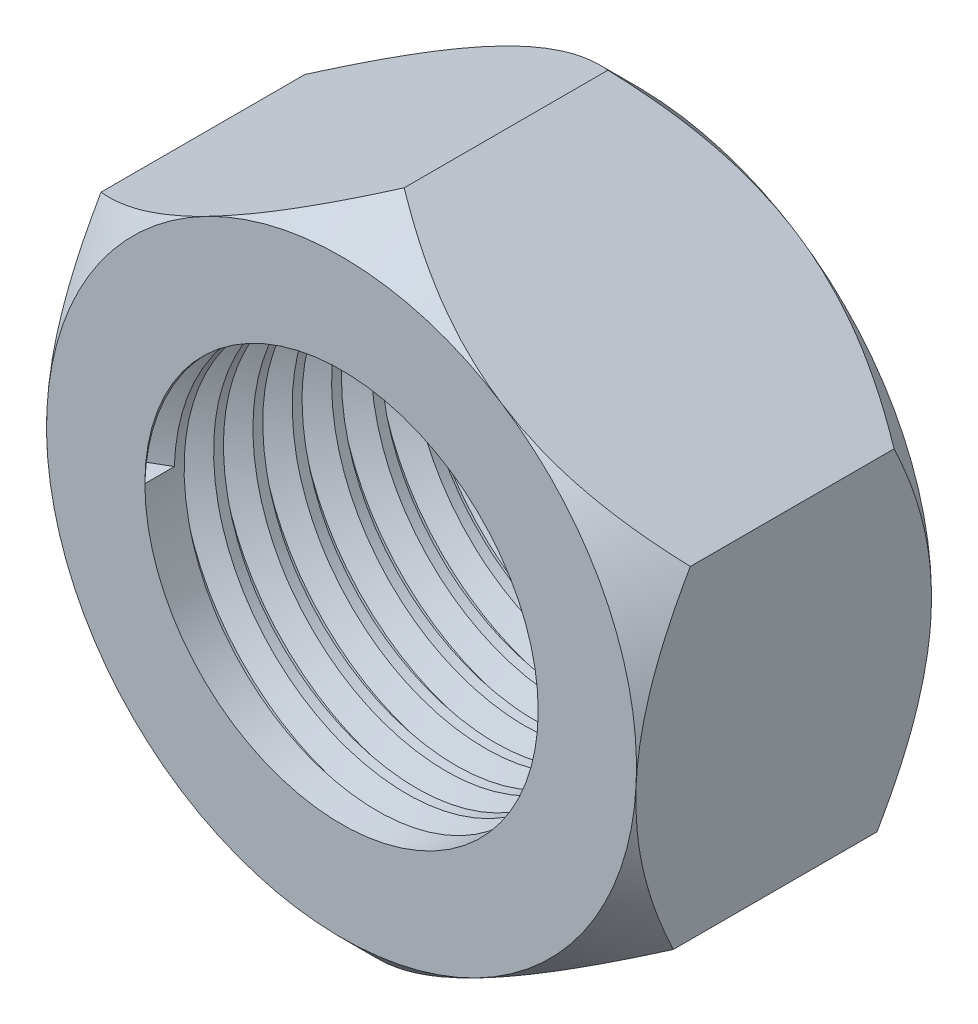
from build123d import *
from build123d.topology import SkipClean

# Parameters (mm, degrees)
SKETCH1_R           = 10
BOSS_EXTRUDE2_DEPTH = 15
SKETCH2_OUTSIDE_W   = 72.57
SKETCH2_OUTSIDE_H   = 76.34
SKETCH2_OUTSIDE_R   = 15
CUT_EXTRUDE3_DEPTH  = 15
CUT_EXTRUDE3_TAPER  = 45
SKETCH3_OUTSIDE_W   = 72.57
SKETCH3_OUTSIDE_H   = 76.34
SKETCH3_OUTSIDE_R   = 15
CUT_EXTRUDE4_DEPTH  = 15
CUT_EXTRUDE4_TAPER  = 45
THREAD1_PITCH       = 2


with BuildPart() as part:
    # Sketch1 → Boss-Extrude2 (new body)
    with BuildSketch(Plane.XY):
        Polygon((-15.414478728, -7.8989775), (-0.866524185, -17.298818914), (14.547954543, -9.399841415), (15.414478728, 7.8989775), (0.866524185, 17.298818914), (-14.547954543, 9.399841415), align=None)
        Circle(SKETCH1_R, mode=Mode.SUBTRACT)
    extrude(amount=-BOSS_EXTRUDE2_DEPTH)

    # Sketch2 outside → Cut-Extrude3 (cut)
    with BuildSketch(Plane.XY):
        Rectangle(SKETCH2_OUTSIDE_W, SKETCH2_OUTSIDE_H)
        Circle(SKETCH2_OUTSIDE_R, mode=Mode.SUBTRACT)
    extrude(amount=-CUT_EXTRUDE3_DEPTH, taper=CUT_EXTRUDE3_TAPER, mode=Mode.SUBTRACT)

    # Sketch3 outside → Cut-Extrude4 (cut)
    with BuildSketch(Plane(origin=(0, 0, -15), x_dir=(-1, 0, 0), z_dir=(0, 0, -1))):
        Rectangle(SKETCH3_OUTSIDE_W, SKETCH3_OUTSIDE_H)
        Circle(SKETCH3_OUTSIDE_R, mode=Mode.SUBTRACT)
    extrude(amount=-CUT_EXTRUDE4_DEPTH, taper=CUT_EXTRUDE4_TAPER, mode=Mode.SUBTRACT)

    # Thread1: the profile of Thread Profile3 profile screwed along a right-hand helix of 7.5 turns, 10 arcs to a turn; built about Z, then put on its axis
    with SkipClean():  # the faces are left unmerged after this step: merging them gives an invalid solid
        thread1_z = Axis((0, 0, 0), (0, 0, 1))
        thread1_corners = [(9.9997, 0, -0.000173205), (11.08253175, 0, 0.624999997), (11.08253175, 0, 0.874999997), (9.9997, 0, 1.5001732)]
        with BuildLine(mode=Mode.PRIVATE) as thread1_profile:
            Line(thread1_corners[0], thread1_corners[1])
            Line(thread1_corners[1], thread1_corners[2])
            Line(thread1_corners[2], thread1_corners[3])
            Line(thread1_corners[3], thread1_corners[0])
        thread1_cap = Face(thread1_profile.wire())
        thread1_turn_angles = [0, 18, 36, 54, 72, 90, 108, 126, 144, 162, 180, 198, 216, 234, 252, 270, 288, 306, 324, 342, 360]
        thread1_turn_weights = [1, 0.9510565162951535, 1, 0.9510565162951535, 1, 0.9510565162951535, 1, 0.9510565162951535, 1, 0.9510565162951535, 1, 0.9510565162951535, 1, 0.9510565162951535, 1, 0.9510565162951535, 1, 0.9510565162951535, 1, 0.9510565162951535, 1]
        thread1_turn_rails = [Edge.make_bspline([Vector(p[0], p[1], 0).rotate(thread1_z, thread1_turn_angles[k]) / thread1_turn_weights[k] + Vector(0, 0, p[2] + THREAD1_PITCH * thread1_turn_angles[k] / 360) for k in range(21)], [0, 0, 0, 1, 1, 2, 2, 3, 3, 4, 4, 5, 5, 6, 6, 7, 7, 8, 8, 9, 9, 10, 10, 10], 2, thread1_turn_weights) for p in thread1_corners]
        thread1_turn_sides = [Face.make_surface_from_curves(thread1_turn_rails[p[0]], thread1_turn_rails[p[1]]) for p in [(0, 1), (1, 2), (2, 3), (3, 0)]]
        thread1_last_angles = [2520, 2538, 2556, 2574, 2592, 2610, 2628, 2646, 2664, 2682, 2700]
        thread1_last_weights = [1, 0.9510565162951535, 1, 0.9510565162951535, 1, 0.9510565162951535, 1, 0.9510565162951535, 1, 0.9510565162951535, 1]
        thread1_last_rails = [Edge.make_bspline([Vector(p[0], p[1], 0).rotate(thread1_z, thread1_last_angles[k]) / thread1_last_weights[k] + Vector(0, 0, p[2] + THREAD1_PITCH * thread1_last_angles[k] / 360) for k in range(11)], [0, 0, 0, 1, 1, 2, 2, 3, 3, 4, 4, 5, 5, 5], 2, thread1_last_weights) for p in thread1_corners]
        thread1_last_sides = [Face.make_surface_from_curves(thread1_last_rails[p[0]], thread1_last_rails[p[1]]) for p in [(0, 1), (1, 2), (2, 3), (3, 0)]]
        thread1 = Plane(origin=(0, 0, 0), x_dir=(-1, 0, 0), z_dir=(0, 0, -1)) * Solid(Shell([*[p.moved(Location((0, 0, THREAD1_PITCH * i))) for i in range(7) for p in thread1_turn_sides], *thread1_last_sides, thread1_cap, thread1_cap.rotate(thread1_z, 2700).moved(Location((0, 0, THREAD1_PITCH * 2700 / 360)))]))
        add(thread1, mode=Mode.SUBTRACT)


solid = part.part
